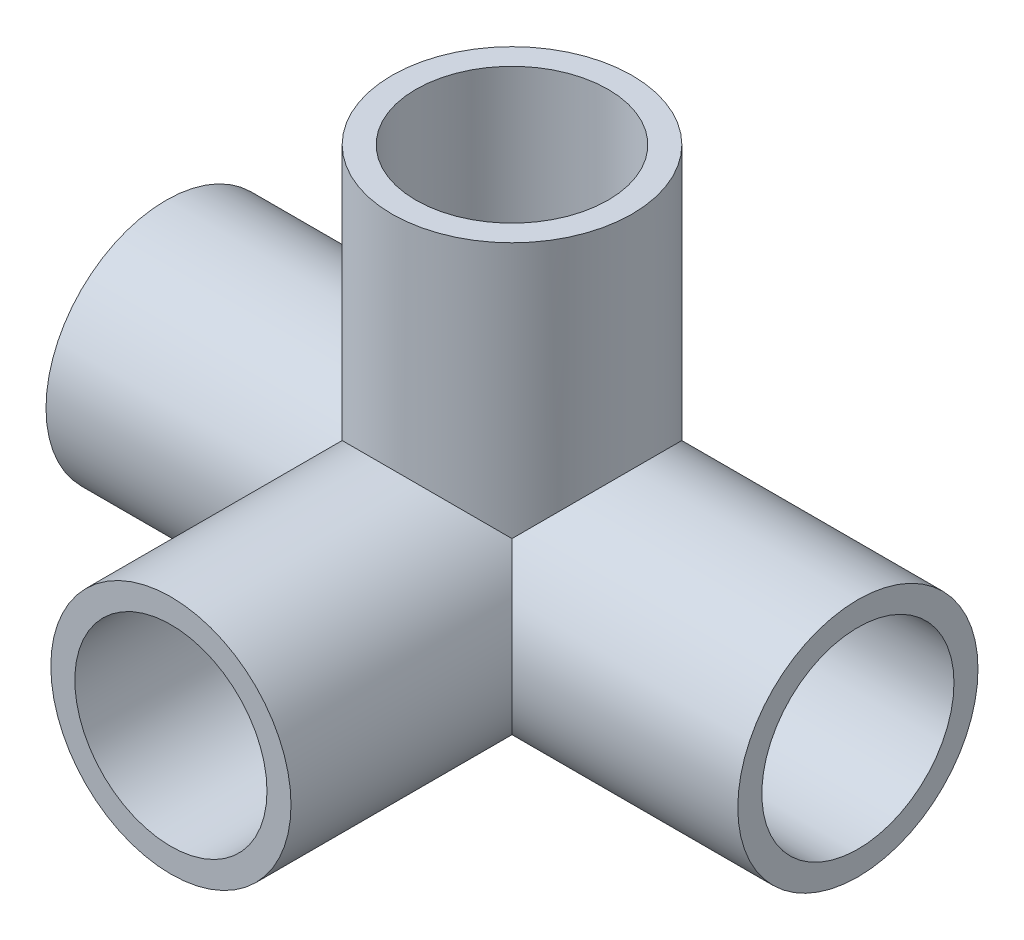
from build123d import *

# Parameters (mm, degrees)
SKETCH_1_R      = 10
EXTRUDE_1_DEPTH = 36
SKETCH_2_R      = 10
EXTRUDE_2_DEPTH = 35.5
SKETCH_3_R      = 10
EXTRUDE_3_DEPTH = 35.5
SHELL_1_T       = 2.5


with BuildPart() as part:
    # 草图1 → 凸台-拉伸1 (new, symmetric)
    with BuildSketch(Plane(origin=(0, 0, 0), x_dir=(0, 0, -1), z_dir=(1, 0, 0))):
        Circle(SKETCH_1_R)
    extrude(amount=EXTRUDE_1_DEPTH, both=True)

    # 草图2 → 凸台-拉伸2 (add)
    with BuildSketch(Plane(origin=(0, 0, 0), x_dir=(1, 0, 0), z_dir=(0, 1, 0))):
        Circle(SKETCH_2_R)
    extrude(amount=EXTRUDE_2_DEPTH)

    # 草图3 → 凸台-拉伸3 (add)
    with BuildSketch(Plane.XY):
        Circle(SKETCH_3_R)
    extrude(amount=EXTRUDE_3_DEPTH)

    # 抽壳1
    shell_1_openings = [part.faces().sort_by_distance(p)[0] for p in [
        (-36, 0, 0),
        (36, 0, 0),
        (0, 0, 35.5),
        (0, 35.5, 0),
    ]]
    offset(amount=SHELL_1_T, openings=shell_1_openings)


solid = part.part
